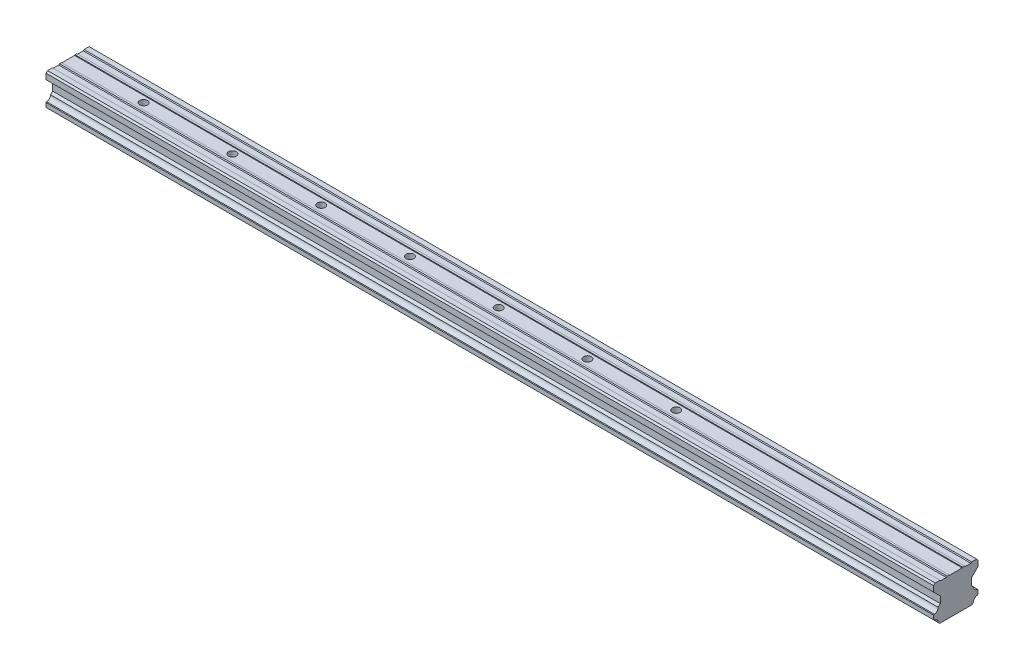
from build123d import *

# Parameters (mm, degrees)
BOSS_EXTRUDE1_DEPTH = 400
HOLE1_D             = 3.5
HOLE1_CBORE_D       = 6
HOLE1_CBORE_DEPTH   = 4.5
LPATTERN1_COUNT     = 7
LPATTERN1_PITCH     = 40


with BuildPart() as part:
    # Sketch1 → Boss-Extrude1 (new body)
    with BuildSketch(Plane(origin=(0, 0, 0), x_dir=(0, 0, -1), z_dir=(1, 0, 0))):
        with BuildLine():
            Line((-7.965754986, -7.693975449), (-7.266272068, -8.393458366))
            Line((-7.266272068, -8.393458366), (7.266272068, -8.393458366))
            Line((7.266272068, -8.393458366), (7.965754986, -7.693975449))
            ThreePointArc((7.965754986, -7.693975449), (8.474723757, -6.421557866), (9.747437917, -5.913331162))
            Line((9.747437917, -5.913331162), (10.000000437, -5.660768637))
            Line((10.000000437, -5.660768637), (10.000000437, -3.788406023))
            Line((10.000000437, -3.788406023), (9.747437912, -3.535843503))
            ThreePointArc((9.747437912, -3.535843503), (8.462742055, -3.016656911), (7.965755402, -1.72321096))
            Line((7.965755402, -1.72321096), (7.005148341, -0.762603918))
            Line((7.005148341, -0.762603918), (7.005148341, 2.166206023))
            Line((7.005148341, 2.166206023), (10.000000347, 5.161058089))
            Line((10.000000347, 5.161058089), (10.000000347, 7.712387211))
            Line((10.000000347, 7.712387211), (9.408464779, 8.393458268))
            Line((9.408464779, 8.393458268), (7.133016457, 8.393458268))
            Line((7.133016457, 8.393458268), (6.789534443, 8.049976247))
            Line((6.789534443, 8.049976247), (4.271139656, 8.049976247))
            Line((4.271139656, 8.049976247), (3.927707784, 8.393458265))
            Line((3.927707784, 8.393458265), (3.061282509, 8.393458265))
            Line((3.061282509, 8.393458265), (2.872049327, 8.204225079))
            Line((2.872049327, 8.204225079), (-2.87204886, 8.204225079))
            Line((-2.87204886, 8.204225079), (-3.061282046, 8.393458261))
            Line((-3.061282046, 8.393458261), (-3.927707321, 8.393458261))
            Line((-3.927707321, 8.393458261), (-4.271189216, 8.049976359))
            Line((-4.271189216, 8.049976359), (-6.789534095, 8.049976359))
            Line((-6.789534095, 8.049976359), (-7.133016116, 8.393458373))
            Line((-7.133016116, 8.393458373), (-9.30771733, 8.393458373))
            Line((-9.30771733, 8.393458373), (-10, 7.70117569))
            Line((-10, 7.70117569), (-10, 5.161058187))
            Line((-10, 5.161058187), (-7.005147934, 2.166206181))
            Line((-7.005147934, 2.166206181), (-7.005147934, -0.76260376))
            Line((-7.005147934, -0.76260376), (-7.965754986, -1.723210812))
            ThreePointArc((-7.965754986, -1.723210812), (-8.462741848, -3.016656549), (-9.747437477, -3.535843372))
            Line((-9.747437477, -3.535843372), (-10, -3.788405895))
            Line((-10, -3.788405895), (-10, -5.660768509))
            Line((-10, -5.660768509), (-9.747437477, -5.913331032))
            ThreePointArc((-9.747437477, -5.913331032), (-8.474723558, -6.421557943), (-7.965754986, -7.693975449))
        make_face()
    extrude(amount=BOSS_EXTRUDE1_DEPTH)

    # Hole1 (through all)
    with Locations(Plane(origin=(34, -8.393458366, 0), x_dir=(0, 0, -1), z_dir=(0, -1, 0))):
        with Locations((0, 0)):
            hole1 = CounterBoreHole(HOLE1_D / 2, HOLE1_CBORE_D / 2, HOLE1_CBORE_DEPTH)

    # LPattern1: Hole1 ×7
    with Locations(*[(i * LPATTERN1_PITCH, 0, 0) for i in range(1, LPATTERN1_COUNT)]):
        add(hole1, mode=Mode.SUBTRACT)


solid = part.part
